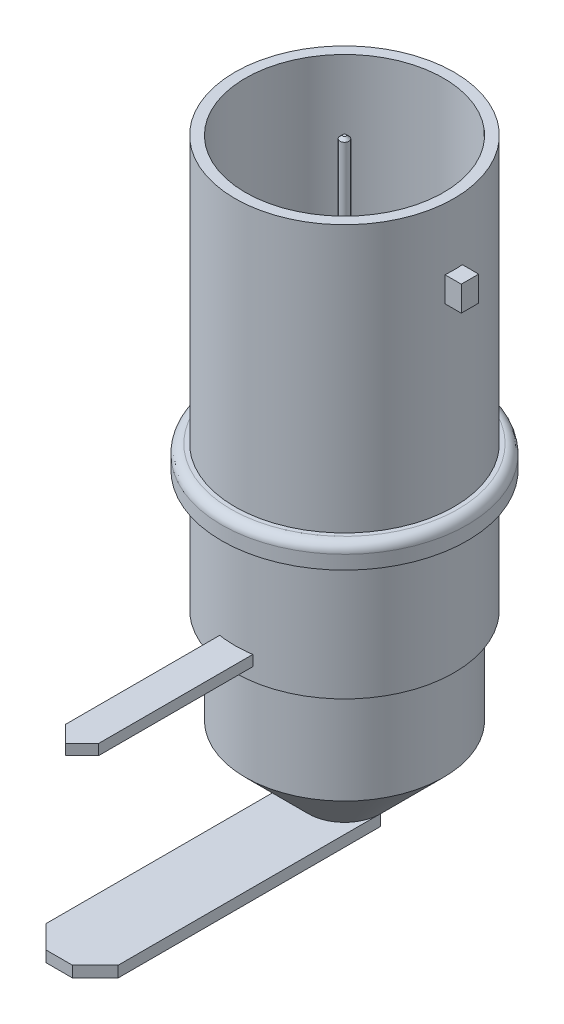
from build123d import *

# Parameters (mm, degrees)
SKETCH1_R                = 4.8
SKETCH1_R_2              = 4.341497015
BOSS_EXTRUDE1_DEPTH      = 18
SKETCH2_R                = 5.380109722
SKETCH2_R_2              = 4.8
BOSS_EXTRUDE2_DEPTH      = 1
FILLET1_R                = 0.4
SKETCH3_W                = 0.886095775
SKETCH3_H                = 1.101271723
BOSS_EXTRUDE3_DEPTH      = 0.381
SKETCH4_R                = 0.194934423
BOSS_EXTRUDE4_DEPTH      = 12.7
CHAMFER1_SIZE            = 0.127
SKETCH6_W                = 1.45
SKETCH6_H                = 0.463784272
BOSS_EXTRUDE5_DEPTH      = 12.5
SKETCH6_W_2              = 3.16
SKETCH6_H_2              = 0.48490007
BOSS_EXTRUDE5_2_DEPTH    = 12.5
CHAMFER2_SIZE            = 1
CHAMFER3_SIZE            = 1
BOSS_EXTRUDE6_DEPTH      = 4
BOSS_EXTRUDE6_DEPTH_BACK = 12.5
SKETCH7_R                = 4.341497015
CHAMFER4_SIZE            = 3


with BuildPart() as part:
    # Sketch1 → Boss-Extrude1 (new body)
    with BuildSketch(Plane(origin=(0, 0, 0), x_dir=(1, 0, 0), z_dir=(0, 1, 0))):
        with Locations(Location((0, 0, 0), (0, 0, 270))):
            Circle(SKETCH1_R)
        with Locations(Location((0, 0, 0), (0, 0, 270))):
            Circle(SKETCH1_R_2, mode=Mode.SUBTRACT)
    extrude(amount=BOSS_EXTRUDE1_DEPTH)

    # Sketch2 → Boss-Extrude2 (add)
    with BuildSketch(Plane(origin=(0, 5.3, 0), x_dir=(1, 0, 0), z_dir=(0, 1, 0))):
        with Locations(Location((0, 0, 0), (0, 0, 270))):
            Circle(SKETCH2_R)
        with Locations(Location((0, 0, 0), (0, 0, 270))):
            Circle(SKETCH2_R_2, mode=Mode.SUBTRACT)
    extrude(amount=BOSS_EXTRUDE2_DEPTH)

    # Fillet1
    fillet1_edges = [part.edges().sort_by_distance(p)[0] for p in [
        (0, 6.3, -5.380109722),
    ]]
    fillet(fillet1_edges, radius=FILLET1_R)

    # Sketch3 → Boss-Extrude3 (add, symmetric)
    with BuildSketch(Plane.XY):
        with Locations((-5.056952113, 14.74105587)):
            Rectangle(SKETCH3_W, SKETCH3_H)
        with Locations((5.056952113, 14.74105587)):
            Rectangle(SKETCH3_W, SKETCH3_H)
    extrude(amount=BOSS_EXTRUDE3_DEPTH, both=True)


with BuildPart() as body_2:
    # Sketch4 → Boss-Extrude4 (new body)
    with BuildSketch(Plane(origin=(0, 5.3, 0), x_dir=(1, 0, 0), z_dir=(0, 1, 0))):
        with Locations(Location((0, 0, 0), (0, 0, 270))):
            Circle(SKETCH4_R)
    extrude(amount=BOSS_EXTRUDE4_DEPTH)

    # Chamfer1
    chamfer1_edges = [body_2.edges().sort_by_distance(p)[0] for p in [
        (0, 18, -0.194934423),
    ]]
    chamfer(chamfer1_edges, length=CHAMFER1_SIZE)


with BuildPart() as body_3:
    # Sketch6 → Boss-Extrude5 (new body)
    with BuildSketch(Plane.XY):
        with Locations((0, 0.8)):
            Rectangle(SKETCH6_W, SKETCH6_H)
    extrude(amount=BOSS_EXTRUDE5_DEPTH)

    # Chamfer2
    # the kernel refuses this chamfer: 1 mm, written as the material it takes off along each edge
    with BuildSketch(Plane(origin=(-0.725, 3.603575124, 12.5), x_dir=(-0.027495876610586403, 0, -0.9996219169112968), z_dir=(0, -1, 0)), Plane(origin=(0.725, -2.003575124, 12.5), x_dir=(0.027495876610586403, 0, -0.9996219169112968), z_dir=(0, 1, 0))) as chamfer2_piece_1:
        Polygon((CHAMFER2_SIZE * 0.999621916911, CHAMFER2_SIZE * 0.0274958766106), (-CHAMFER2_SIZE * 0.0274958766106, CHAMFER2_SIZE * 0.999621916911), (0, 0), align=None)
    extrude(amount=5.607150248, mode=Mode.SUBTRACT)


with BuildPart() as body_4:
    # Sketch6 → Boss-Extrude5 2 (new body)
    with BuildSketch(Plane.XY):
        with Locations((0, -7.2)):
            Rectangle(SKETCH6_W_2, SKETCH6_H_2)
    extrude(amount=BOSS_EXTRUDE5_2_DEPTH)

    # Chamfer3
    chamfer3_edges = [body_4.edges().sort_by_distance(p)[0] for p in [
        (-1.58, -7.2, 12.5),
        (1.58, -7.2, 12.5),
    ]]
    chamfer(chamfer3_edges, length=CHAMFER3_SIZE)


with BuildPart() as body_5:
    # Sketch7 → Boss-Extrude6 (new, two sides: drawn at the far end of the back side and taken through both)
    with BuildSketch(Plane(origin=(0, 5.3, 0), x_dir=(1, 0, 0), z_dir=(0, 1, 0)).offset(-BOSS_EXTRUDE6_DEPTH_BACK)):
        with Locations(Location((0, 0, 0), (0, 0, 270))):
            Circle(SKETCH7_R)
    extrude(amount=BOSS_EXTRUDE6_DEPTH + BOSS_EXTRUDE6_DEPTH_BACK)

    # Chamfer4
    chamfer4_edges = [body_5.edges().sort_by_distance(p)[0] for p in [
        (0, -7.2, -4.341497015),
    ]]
    chamfer(chamfer4_edges, length=CHAMFER4_SIZE)


solid = Compound([part.part, body_2.part, body_3.part, body_4.part, body_5.part])
